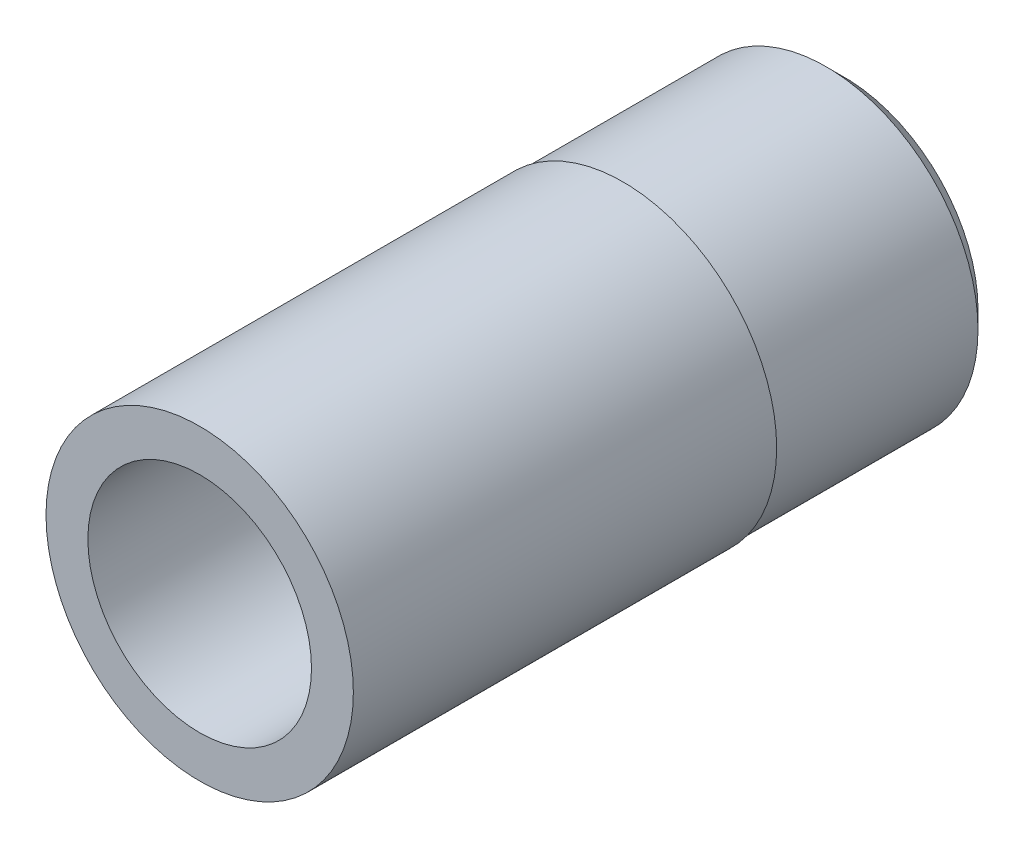
from build123d import *

# Parameters (mm, degrees)
SKETCH1_R           = 16.7
SKETCH1_R_2         = 12.15
BOSS_EXTRUDE1_DEPTH = 70


# Read off the part's stored shape, not the designer's step: M33x3.5 Machine Threads Stud1
with BuildPart() as part:
    # Sketch1 → Boss-Extrude1 (new body)
    with BuildSketch(Plane.XY):
        Circle(SKETCH1_R)
        Circle(SKETCH1_R_2, mode=Mode.SUBTRACT)
    extrude(amount=BOSS_EXTRUDE1_DEPTH)

    # M33x3.5 Machine Threads Stud1 outline → M33x3.5 Machine Threads Stud1 (revolve, cut)
    with BuildSketch(Plane.XZ):
        Polygon((14.579, 0), (16.7, 0), (16.7, 24), (16.5, 24), (16.5, 1.921), align=None)
    revolve(axis=Axis((0, 0, 0), (0, 0, 1)), mode=Mode.SUBTRACT)


solid = part.part
